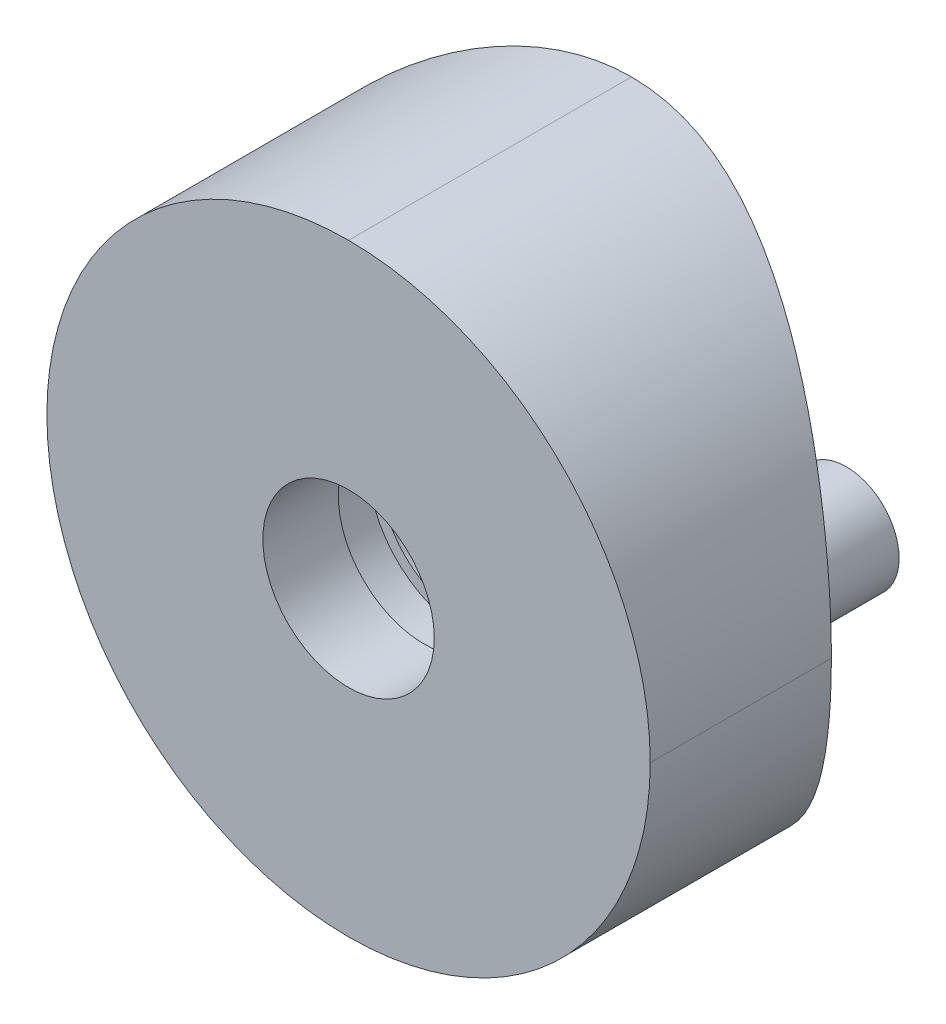
from build123d import *

# Parameters (mm, degrees)
BOSS_EXTRUDE2_DEPTH     = 20
FILLET1_R               = 10
CUT_EXTRUDE2_REACH      = 31.799
CUT_EXTRUDE2_END_RADIUS = 16.5
SKETCH4_R               = 2.8408
CUT_EXTRUDE3_START      = -2.5
SKETCH5_R               = 3.21845
CUT_EXTRUDE3_DEPTH      = 1.38
BOSS_EXTRUDE3_START     = -6
SKETCH6_R               = 1.75
BOSS_EXTRUDE3_DEPTH     = 4


with BuildPart() as part:
    # Sketch3 → Boss-Extrude2 (new body)
    with BuildSketch(Plane(origin=(0, 0, 0), x_dir=(0, 0, -1), z_dir=(1, 0, 0))):
        with BuildLine():
            Line((0, 20), (-9.38, 20))
            Line((-9.38, 20), (-9.38, 0))
            Line((-9.38, 0), (0, 0))
            ThreePointArc((0, 0), (-3.375595252, 10), (0, 20))
        make_face()
    extrude(amount=BOSS_EXTRUDE2_DEPTH)

    # Fillet1
    fillet1_edges = [part.edges().sort_by_distance(p)[0] for p in [
        (20, 0, 4.69),
        (0, 0, 4.69),
        (20, 20, 4.69),
        (0, 20, 4.69),
    ]]
    fillet(fillet1_edges, radius=FILLET1_R - 0.0001)  # a hair under: the kernel refuses the full size

    # Cut-Extrude2: up to this cylinder (the profile starts outside it)
    cut_extrude2_end = Plane(origin=(10, 10, -13.124404748), z_dir=(-1, 0, 0)) * Cylinder(CUT_EXTRUDE2_END_RADIUS, 97.598, mode=Mode.PRIVATE)
    # Sketch4 → Cut-Extrude2 (cut, up to the surface)
    with BuildSketch(Plane.XY.offset(9.38), mode=Mode.PRIVATE) as cut_extrude2_sk1:
        with Locations((10, 10)):
            Circle(SKETCH4_R)
    cut_extrude2_tool1 = extrude(cut_extrude2_sk1.sketch, amount=-CUT_EXTRUDE2_REACH, mode=Mode.PRIVATE) - cut_extrude2_end
    add(cut_extrude2_tool1.solids().sort_by_distance((10, 10, 9.38))[0], mode=Mode.SUBTRACT)

    # Sketch5 → Cut-Extrude3 (cut)
    with BuildSketch(Plane.XY.offset(9.38).offset(CUT_EXTRUDE3_START)):
        with Locations((10, 10)):
            Circle(SKETCH5_R)
    extrude(amount=-CUT_EXTRUDE3_DEPTH, mode=Mode.SUBTRACT)

    # Sketch6 → Boss-Extrude3 (add)
    with BuildSketch(Plane.XY.offset(9.38).offset(BOSS_EXTRUDE3_START)):
        with Locations((3.5, 10)):
            Circle(SKETCH6_R)
        with Locations((16.5, 10)):
            Circle(SKETCH6_R)
    extrude(amount=-BOSS_EXTRUDE3_DEPTH)


solid = part.part
